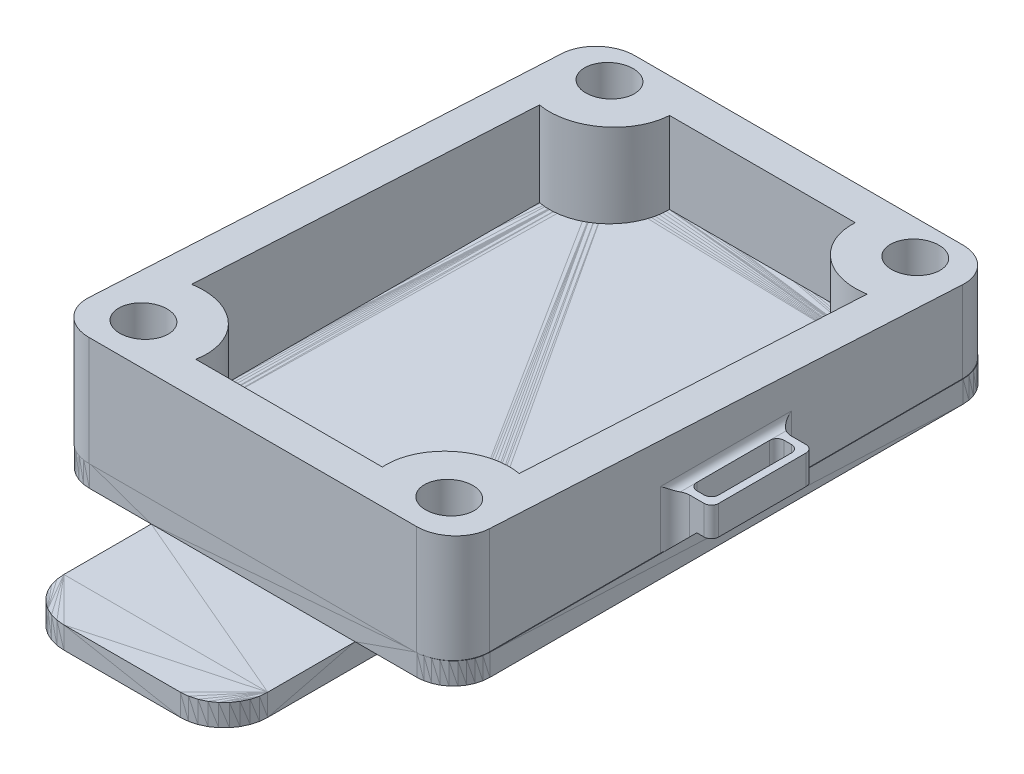
from build123d import *

# Parameters (mm, degrees)
SKETCH2_W                  = 55
SKETCH2_H                  = 75
BOSS_EXTRUDE1_DEPTH        = 15
FILLET1_R                  = 5
SKETCH3_R                  = 3.25
CUT_EXTRUDE1_DEPTH         = 49.862050714
SKETCH4_W                  = 28
SKETCH4_H                  = 10
SKETCH4_H_2                = 12.75
SKETCH4_H_3                = 48.5
SKETCH4_W_2                = 8.5
SKETCH4_H_4                = 13.75
SKETCH4_H_5                = 18
BOSS_EXTRUDE2_DEPTH        = 3
FILLET2_R                  = 6
FILLET3_R                  = 6
SKETCH6_W                  = 76.197677356
SKETCH6_H                  = 123.01265962
CUT_EXTRUDE4_DEPTH         = 3
CUT_EXTRUDE5_DEPTH         = 49.862050714
CUT_EXTRUDE5_DEPTH_BACK    = 49.862050714
CUT_EXTRUDE6_DEPTH         = 69.23672032
CUT_EXTRUDE6_DEPTH_BACK    = 69.23672032
BOSS_EXTRUDE3_START        = -3
SKETCH8_W                  = 5
SKETCH8_H                  = 14
BOSS_EXTRUDE3_DEPTH        = 4
SKETCH9_W                  = 3
SKETCH9_H                  = 12
CUT_EXTRUDE7_DEPTH         = 51.264301447
CHAMFER1_SIZE              = 3
FILLET4_R                  = 1
FILLET5_R                  = 2
FILLET6_R                  = 1
CHAMFER2_SIZE              = 3
FILLET7_R                  = 1
FILLET8_R                  = 2
FILLET9_R                  = 1
SPLIT1_START               = -32.5
SPLIT1_OUTLINE_W           = 12
SPLIT1_OUTLINE_H           = 22
SPLIT1_DEPTH               = 5
SPLIT1_START_2             = 27.5
SPLIT1_2_OUTLINE_W         = 12
SPLIT1_2_OUTLINE_H         = 22
SPLIT1_2_DEPTH             = 5
SPLIT1_START_3             = 3
SPLIT1_3_DEPTH             = 4
SPLIT1_START_4             = -9.0000001
SPLIT1_4_DEPTH             = 18.0000001
SPLIT1_START_5             = -8.678632008
SPLIT1_5_DEPTH             = 3.678632008
SPLIT1_START_6             = 5
SPLIT1_6_DEPTH             = 2.30116
SPLIT1_START_7             = -1
SPLIT1_7_DEPTH             = 4
SPLIT1_START_8             = 7
SPLIT1_8_DEPTH             = 2
SPLIT1_9_DEPTH             = 4
SPLIT1_10_DEPTH            = 18.0000001
SPLIT1_11_DEPTH            = 3.678632008
SPLIT1_12_DEPTH            = 2.30116
SPLIT1_13_DEPTH            = 4
SPLIT1_14_DEPTH            = 2
TRUCKS_SPACER_REVC_START   = 111.078258223
TRUCKS_SPACER_REVC_DEPTH   = 6.000000052
TRUCKS_SPACER_REVC_START_2 = 114.078258249
TRUCKS_SPACER_REVC_2_DEPTH = 3.000000026
TRUCKS_SPACER_REVC_3_DEPTH = 3.000000026


with BuildPart() as part:
    # Sketch2 → Boss-Extrude1 (new body)
    with BuildSketch(Plane(origin=(0, 0, 0), x_dir=(1, 0, 0), z_dir=(0, 1, 0))):
        Rectangle(SKETCH2_W, SKETCH2_H)
    extrude(amount=BOSS_EXTRUDE1_DEPTH)

    # Fillet1
    fillet1_edges = [part.edges().sort_by_distance(p)[0] for p in [
        (27.5, 7.5, 37.5),
        (-27.5, 7.5, 37.5),
        (-27.5, 7.5, -37.5),
        (27.5, 7.5, -37.5),
    ]]
    fillet(fillet1_edges, radius=FILLET1_R)

    # Sketch3 → Cut-Extrude1 (cut, through all)
    with BuildSketch(Plane(origin=(0, 15, 0), x_dir=(1, 0, 0), z_dir=(0, 1, 0))):
        with Locations(Location((-21, 32.5, 0), (0, 0, 270))):
            Circle(SKETCH3_R)
        with Locations(Location((21, 32.5, 0), (0, 0, 270))):
            Circle(SKETCH3_R)
        with Locations(Location((21, -31.5, 0), (0, 0, 270))):
            Circle(SKETCH3_R)
        with Locations(Location((-21, -31.5, 0), (0, 0, 270))):
            Circle(SKETCH3_R)
    extrude(amount=-CUT_EXTRUDE1_DEPTH, mode=Mode.SUBTRACT)

    # Sketch4 → Boss-Extrude2 (add)
    with BuildSketch(Plane.XZ):
        with Locations((0, -42.5)):
            Rectangle(SKETCH4_W, SKETCH4_H)
        with Locations((0, -31.125)):
            Rectangle(SKETCH4_W, SKETCH4_H_2)
        with Locations((0, -0.5)):
            Rectangle(SKETCH4_W, SKETCH4_H_3)
        with Locations((18.25, -0.5)):
            Rectangle(SKETCH4_W_2, SKETCH4_H_3)
        with Locations((-18.25, -0.5)):
            Rectangle(SKETCH4_W_2, SKETCH4_H_3)
        with Locations((0, 30.625)):
            Rectangle(SKETCH4_W, SKETCH4_H_4)
        with Locations((0, 46.5)):
            Rectangle(SKETCH4_W, SKETCH4_H_5)
    extrude(amount=BOSS_EXTRUDE2_DEPTH)

    # Fillet2
    fillet2_edges = [part.edges().sort_by_distance(p)[0] for p in [
        (22.5, -1.5, -24.75),
        (22.5, -1.5, 23.75),
        (-22.5, -1.5, 23.75),
        (-22.5, -1.5, -24.75),
    ]]
    fillet(fillet2_edges, radius=FILLET2_R)

    # Fillet3
    fillet3_edges = [part.edges().sort_by_distance(p)[0] for p in [
        (-14, -1.5, -47.5),
        (14, -1.5, -47.5),
        (14, -1.5, 55.5),
        (-14, -1.5, 55.5),
    ]]
    fillet(fillet3_edges, radius=FILLET3_R)

    # Sketch6 → Cut-Extrude4 (cut)
    with BuildSketch(Plane.XZ.offset(3)):
        Rectangle(SKETCH6_W, SKETCH6_H)
    extrude(amount=-CUT_EXTRUDE4_DEPTH, mode=Mode.SUBTRACT)

    # Sketch5 → Cut-Extrude5 (cut, two sides: drawn at the far end of the back side and taken through both)
    with BuildSketch(Plane(origin=(0, 15, 0), x_dir=(1, 0, 0), z_dir=(0, 1, 0)).offset(-CUT_EXTRUDE5_DEPTH_BACK)):
        with BuildLine():
            ThreePointArc((-12.810830323, -32.5), (-15.347954536, -25.49026772), (-22.5, -23.38750963))
            Line((-22.5, -23.38750963), (-22.5, 24.38750963))
            ThreePointArc((-22.5, 24.38750963), (-15.72328227, 26.158174553), (-12.75, 32.5))
            Line((-12.75, 32.5), (-9, 32.5))
            Line((-9, 32.5), (9, 32.5))
            Line((9, 32.5), (12.75, 32.5))
            ThreePointArc((12.75, 32.5), (15.72328227, 26.158174553), (22.5, 24.38750963))
            Line((22.5, 24.38750963), (22.5, -23.38750963))
            ThreePointArc((22.5, -23.38750963), (15.347954536, -25.49026772), (12.810830323, -32.5))
            Line((12.810830323, -32.5), (9, -32.5))
            Line((9, -32.5), (-9, -32.5))
            Line((-9, -32.5), (-12.810830323, -32.5))
        make_face()
    extrude(amount=CUT_EXTRUDE5_DEPTH + CUT_EXTRUDE5_DEPTH_BACK, mode=Mode.SUBTRACT)

    # Sketch7 → Cut-Extrude6 (cut, two sides: drawn at the far end of the back side and taken through both)
    with BuildSketch(Plane(origin=(27.5, 0, 0), x_dir=(0, 0, -1), z_dir=(1, 0, 0)).offset(-CUT_EXTRUDE6_DEPTH_BACK)):
        Polygon((200.470585408, 15), (37.5, 15), (32.5, 15), (-32.5, 15), (-37.5, 15), (37.5, 11), (200.239298315, 2.320570757), (526.12625603, -3.62397497), (526.357543123, 9.055454274), align=None)
    extrude(amount=CUT_EXTRUDE6_DEPTH + CUT_EXTRUDE6_DEPTH_BACK, mode=Mode.SUBTRACT)

    # Sketch8 → Boss-Extrude3 (add)
    with BuildSketch(Plane.XZ.offset(BOSS_EXTRUDE3_START)):
        with Locations((-30, 0)):
            Rectangle(SKETCH8_W, SKETCH8_H)
    boss_extrude3 = extrude(amount=-BOSS_EXTRUDE3_DEPTH)

    # Sketch9 → Cut-Extrude7 (cut, symmetric)
    with BuildSketch(Plane(origin=(0, 7, 0), x_dir=(1, 0, 0), z_dir=(0, 1, 0))):
        with Locations((-30, 0)):
            Rectangle(SKETCH9_W, SKETCH9_H)
    cut_extrude7 = extrude(amount=CUT_EXTRUDE7_DEPTH, both=True, mode=Mode.SUBTRACT)

    # Chamfer1
    # the kernel refuses this chamfer: 3 mm, written as the material it adds along each edge
    with BuildSketch(Plane(origin=(-27.5, 3, -7), x_dir=(0, -1, 0), z_dir=(0, 0, 1))) as chamfer1_piece_1_section:
        Polygon((CHAMFER1_SIZE, 0), (0, -CHAMFER1_SIZE), (0, 0), align=None)
    chamfer1_piece_1 = extrude(amount=14, mode=Mode.PRIVATE)
    chamfer1_piece_1 = split(chamfer1_piece_1, bisect_by=Plane(origin=(-27.5, 0, -7), z_dir=(0, 1, 0)), keep=Keep.TOP, mode=Mode.PRIVATE)
    chamfer1_piece_1 = split(chamfer1_piece_1, bisect_by=Plane(origin=(-27.5, 3, -6), z_dir=(0, 0, -1)), keep=Keep.TOP, mode=Mode.PRIVATE)
    chamfer1_piece_1 = split(chamfer1_piece_1, bisect_by=Plane(origin=(-28.5, 3, -7), z_dir=(1, 0, 0)), keep=Keep.TOP, mode=Mode.PRIVATE)
    add(chamfer1_piece_1)
    with BuildSketch(Plane(origin=(-27.5, 3, -7), x_dir=(0, -1, 0), z_dir=(0, 0, 1))) as chamfer1_piece_2_section:
        Polygon((CHAMFER1_SIZE, 0), (0, -CHAMFER1_SIZE), (0, 0), align=None)
    chamfer1_piece_2 = extrude(amount=14, mode=Mode.PRIVATE)
    chamfer1_piece_2 = split(chamfer1_piece_2, bisect_by=Plane(origin=(-27.5, 3, -6), z_dir=(0, 0, -1)), keep=Keep.TOP, mode=Mode.PRIVATE)
    chamfer1_piece_2 = split(chamfer1_piece_2, bisect_by=Plane(origin=(-28.5, 3, -7), z_dir=(-1, 0, 0)), keep=Keep.TOP, mode=Mode.PRIVATE)
    add(chamfer1_piece_2)
    with BuildSketch(Plane(origin=(-27.5, 3, -7), x_dir=(0, -1, 0), z_dir=(0, 0, 1))) as chamfer1_piece_3_section:
        Polygon((CHAMFER1_SIZE, 0), (0, -CHAMFER1_SIZE), (0, 0), align=None)
    chamfer1_piece_3 = extrude(amount=14, mode=Mode.PRIVATE)
    chamfer1_piece_3 = split(chamfer1_piece_3, bisect_by=Plane(origin=(-27.5, 0, -7), z_dir=(0, 1, 0)), keep=Keep.TOP, mode=Mode.PRIVATE)
    chamfer1_piece_3 = split(chamfer1_piece_3, bisect_by=Plane(origin=(-27.5, 3, 6), z_dir=(0, 0, -1)), keep=Keep.TOP, mode=Mode.PRIVATE)
    chamfer1_piece_3 = split(chamfer1_piece_3, bisect_by=Plane(origin=(-27.5, 3, -6), z_dir=(0, 0, 1)), keep=Keep.TOP, mode=Mode.PRIVATE)
    chamfer1_piece_3 = split(chamfer1_piece_3, bisect_by=Plane(origin=(-28.5, 3, -7), z_dir=(1, 0, 0)), keep=Keep.TOP, mode=Mode.PRIVATE)
    add(chamfer1_piece_3)
    with BuildSketch(Plane(origin=(-27.5, 3, -7), x_dir=(0, -1, 0), z_dir=(0, 0, 1))) as chamfer1_piece_4_section:
        Polygon((CHAMFER1_SIZE, 0), (0, -CHAMFER1_SIZE), (0, 0), align=None)
    chamfer1_piece_4 = extrude(amount=14, mode=Mode.PRIVATE)
    chamfer1_piece_4 = split(chamfer1_piece_4, bisect_by=Plane(origin=(-27.5, 0, -7), z_dir=(0, 1, 0)), keep=Keep.TOP, mode=Mode.PRIVATE)
    chamfer1_piece_4 = split(chamfer1_piece_4, bisect_by=Plane(origin=(-27.5, 3, 6), z_dir=(0, 0, 1)), keep=Keep.TOP, mode=Mode.PRIVATE)
    chamfer1_piece_4 = split(chamfer1_piece_4, bisect_by=Plane(origin=(-28.5, 3, -7), z_dir=(1, 0, 0)), keep=Keep.TOP, mode=Mode.PRIVATE)
    add(chamfer1_piece_4)
    with BuildSketch(Plane(origin=(-27.5, 3, -7), x_dir=(0, -1, 0), z_dir=(0, 0, 1))) as chamfer1_piece_5_section:
        Polygon((CHAMFER1_SIZE, 0), (0, -CHAMFER1_SIZE), (0, 0), align=None)
    chamfer1_piece_5 = extrude(amount=14, mode=Mode.PRIVATE)
    chamfer1_piece_5 = split(chamfer1_piece_5, bisect_by=Plane(origin=(-27.5, 3, 6), z_dir=(0, 0, 1)), keep=Keep.TOP, mode=Mode.PRIVATE)
    chamfer1_piece_5 = split(chamfer1_piece_5, bisect_by=Plane(origin=(-28.5, 3, -7), z_dir=(-1, 0, 0)), keep=Keep.TOP, mode=Mode.PRIVATE)
    add(chamfer1_piece_5)

    # Fillet4
    fillet4_edges = [part.edges().sort_by_distance(p)[0] for p in [
        (-32.5, 5, -7),
        (-32.5, 5, 7),
        (-28.5, 4, 6),
        (-31.5, 5, 6),
        (-31.5, 5, -6),
        (-28.5, 4, -6),
    ]]
    fillet(fillet4_edges, radius=FILLET4_R)

    # Fillet5
    # the kernel refuses this fillet: 2 mm, written as the material it adds along each edge
    with BuildSketch(Plane(origin=(-27.5, 7, -7), x_dir=(-1, 0, 0), z_dir=(0, -1, 0))) as fillet5_piece_1_section:
        with BuildLine():
            CenterArc((FILLET5_R, FILLET5_R), FILLET5_R, 180, 90)
            Line((0, FILLET5_R), (0, 0))
            Line((0, 0), (FILLET5_R, 0))
        make_face()
    fillet5_piece_1 = extrude(amount=7, mode=Mode.PRIVATE)
    fillet5_piece_1 = split(fillet5_piece_1, bisect_by=Plane(origin=(-31, 3.5, -7), z_dir=(0.7071067811865476, 0.7071067811865476, 0)), keep=Keep.TOP, mode=Mode.PRIVATE)
    add(fillet5_piece_1)
    with BuildSketch(Plane(origin=(-27.5, 0, 7), x_dir=(-1, 0, 0), z_dir=(0, 1, 0))) as fillet5_piece_2_section:
        with BuildLine():
            CenterArc((FILLET5_R, FILLET5_R), FILLET5_R, 180, 90)
            Line((0, FILLET5_R), (0, 0))
            Line((0, 0), (FILLET5_R, 0))
        make_face()
    fillet5_piece_2 = extrude(amount=7, mode=Mode.PRIVATE)
    fillet5_piece_2 = split(fillet5_piece_2, bisect_by=Plane(origin=(-27.5, 0, 7), z_dir=(0.7071067811865476, 0.7071067811865476, 0)), keep=Keep.TOP, mode=Mode.PRIVATE)
    add(fillet5_piece_2)

    # Fillet6
    fillet6_edges = [part.edges().sort_by_distance(p)[0] for p in [
        (-27.5, 7, 0),
    ]]
    fillet(fillet6_edges, radius=FILLET6_R - 0.0001)  # a hair under: the kernel refuses the full size

    # Mirror1: Boss-Extrude3, Cut-Extrude7 across plane
    add(boss_extrude3.mirror(Plane.ZY))
    add(cut_extrude7.mirror(Plane.ZY), mode=Mode.SUBTRACT)

    # Chamfer2
    # the kernel refuses this chamfer: 3 mm, written as the material it adds along each edge
    with BuildSketch(Plane(origin=(27.5, 3, -7), x_dir=(0, -1, 0), z_dir=(0, 0, 1))) as chamfer2_piece_1_section:
        Polygon((CHAMFER2_SIZE, 0), (0, CHAMFER2_SIZE), (0, 0), align=None)
    chamfer2_piece_1 = extrude(amount=14, mode=Mode.PRIVATE)
    chamfer2_piece_1 = split(chamfer2_piece_1, bisect_by=Plane(origin=(27.5, 0, -7), z_dir=(0, 1, 0)), keep=Keep.TOP, mode=Mode.PRIVATE)
    chamfer2_piece_1 = split(chamfer2_piece_1, bisect_by=Plane(origin=(27.5, 3, -6), z_dir=(0, 0, -1)), keep=Keep.TOP, mode=Mode.PRIVATE)
    chamfer2_piece_1 = split(chamfer2_piece_1, bisect_by=Plane(origin=(28.5, 3, -7), z_dir=(-1, 0, 0)), keep=Keep.TOP, mode=Mode.PRIVATE)
    add(chamfer2_piece_1)
    with BuildSketch(Plane(origin=(27.5, 3, -7), x_dir=(0, -1, 0), z_dir=(0, 0, 1))) as chamfer2_piece_2_section:
        Polygon((CHAMFER2_SIZE, 0), (0, CHAMFER2_SIZE), (0, 0), align=None)
    chamfer2_piece_2 = extrude(amount=14, mode=Mode.PRIVATE)
    chamfer2_piece_2 = split(chamfer2_piece_2, bisect_by=Plane(origin=(27.5, 3, -6), z_dir=(0, 0, -1)), keep=Keep.TOP, mode=Mode.PRIVATE)
    chamfer2_piece_2 = split(chamfer2_piece_2, bisect_by=Plane(origin=(28.5, 3, -7), z_dir=(1, 0, 0)), keep=Keep.TOP, mode=Mode.PRIVATE)
    add(chamfer2_piece_2)
    with BuildSketch(Plane(origin=(27.5, 3, -7), x_dir=(0, -1, 0), z_dir=(0, 0, 1))) as chamfer2_piece_3_section:
        Polygon((CHAMFER2_SIZE, 0), (0, CHAMFER2_SIZE), (0, 0), align=None)
    chamfer2_piece_3 = extrude(amount=14, mode=Mode.PRIVATE)
    chamfer2_piece_3 = split(chamfer2_piece_3, bisect_by=Plane(origin=(27.5, 0, -7), z_dir=(0, 1, 0)), keep=Keep.TOP, mode=Mode.PRIVATE)
    chamfer2_piece_3 = split(chamfer2_piece_3, bisect_by=Plane(origin=(27.5, 3, -6), z_dir=(0, 0, 1)), keep=Keep.TOP, mode=Mode.PRIVATE)
    chamfer2_piece_3 = split(chamfer2_piece_3, bisect_by=Plane(origin=(28.5, 3, -7), z_dir=(-1, 0, 0)), keep=Keep.TOP, mode=Mode.PRIVATE)
    chamfer2_piece_3 = split(chamfer2_piece_3, bisect_by=Plane(origin=(27.5, 3, 6), z_dir=(0, 0, -1)), keep=Keep.TOP, mode=Mode.PRIVATE)
    add(chamfer2_piece_3)
    with BuildSketch(Plane(origin=(27.5, 3, -7), x_dir=(0, -1, 0), z_dir=(0, 0, 1))) as chamfer2_piece_4_section:
        Polygon((CHAMFER2_SIZE, 0), (0, CHAMFER2_SIZE), (0, 0), align=None)
    chamfer2_piece_4 = extrude(amount=14, mode=Mode.PRIVATE)
    chamfer2_piece_4 = split(chamfer2_piece_4, bisect_by=Plane(origin=(27.5, 0, -7), z_dir=(0, 1, 0)), keep=Keep.TOP, mode=Mode.PRIVATE)
    chamfer2_piece_4 = split(chamfer2_piece_4, bisect_by=Plane(origin=(28.5, 3, -7), z_dir=(-1, 0, 0)), keep=Keep.TOP, mode=Mode.PRIVATE)
    chamfer2_piece_4 = split(chamfer2_piece_4, bisect_by=Plane(origin=(27.5, 3, 6), z_dir=(0, 0, 1)), keep=Keep.TOP, mode=Mode.PRIVATE)
    add(chamfer2_piece_4)
    with BuildSketch(Plane(origin=(27.5, 3, -7), x_dir=(0, -1, 0), z_dir=(0, 0, 1))) as chamfer2_piece_5_section:
        Polygon((CHAMFER2_SIZE, 0), (0, CHAMFER2_SIZE), (0, 0), align=None)
    chamfer2_piece_5 = extrude(amount=14, mode=Mode.PRIVATE)
    chamfer2_piece_5 = split(chamfer2_piece_5, bisect_by=Plane(origin=(28.5, 3, -7), z_dir=(1, 0, 0)), keep=Keep.TOP, mode=Mode.PRIVATE)
    chamfer2_piece_5 = split(chamfer2_piece_5, bisect_by=Plane(origin=(27.5, 3, 6), z_dir=(0, 0, 1)), keep=Keep.TOP, mode=Mode.PRIVATE)
    add(chamfer2_piece_5)

    # Fillet7
    fillet7_edges = [part.edges().sort_by_distance(p)[0] for p in [
        (32.5, 5, -7),
        (32.5, 5, 7),
        (31.5, 5, -6),
        (31.5, 5, 6),
        (28.5, 4, -6),
        (28.5, 4, 6),
    ]]
    fillet(fillet7_edges, radius=FILLET7_R)

    # Fillet8
    # the kernel refuses this fillet: 2 mm, written as the material it adds along each edge
    with BuildSketch(Plane(origin=(27.5, 0, -7), x_dir=(1, 0, 0), z_dir=(0, 1, 0))) as fillet8_piece_1_section:
        with BuildLine():
            CenterArc((FILLET8_R, FILLET8_R), FILLET8_R, 180, 90)
            Line((0, FILLET8_R), (0, 0))
            Line((0, 0), (FILLET8_R, 0))
        make_face()
    fillet8_piece_1 = extrude(amount=7, mode=Mode.PRIVATE)
    fillet8_piece_1 = split(fillet8_piece_1, bisect_by=Plane(origin=(27.5, 0, -7), z_dir=(-0.7071067811865476, 0.7071067811865476, 0)), keep=Keep.TOP, mode=Mode.PRIVATE)
    add(fillet8_piece_1)
    with BuildSketch(Plane(origin=(27.5, 7, 7), x_dir=(1, 0, 0), z_dir=(0, -1, 0))) as fillet8_piece_2_section:
        with BuildLine():
            CenterArc((FILLET8_R, FILLET8_R), FILLET8_R, 180, 90)
            Line((0, FILLET8_R), (0, 0))
            Line((0, 0), (FILLET8_R, 0))
        make_face()
    fillet8_piece_2 = extrude(amount=7, mode=Mode.PRIVATE)
    fillet8_piece_2 = split(fillet8_piece_2, bisect_by=Plane(origin=(31, 3.5, 7), z_dir=(-0.7071067811865476, 0.7071067811865476, 0)), keep=Keep.TOP, mode=Mode.PRIVATE)
    add(fillet8_piece_2)

    # Fillet9
    fillet9_edges = [part.edges().sort_by_distance(p)[0] for p in [
        (27.5, 7, 0),
    ]]
    fillet(fillet9_edges, radius=FILLET9_R - 0.0001)  # a hair under: the kernel refuses the full size

    # Split1: read off the stored shape, not the designer's step
    # Split1 outline → Split1 (cut)
    with BuildSketch(Plane.YZ.offset(SPLIT1_START)):
        with Locations((4, 0)):
            Rectangle(SPLIT1_OUTLINE_W, SPLIT1_OUTLINE_H)
    extrude(amount=SPLIT1_DEPTH, mode=Mode.SUBTRACT)

    # Split1 2 outline → Split1 2 (cut)
    with BuildSketch(Plane.YZ.offset(SPLIT1_START_2)):
        with Locations((4, 0)):
            Rectangle(SPLIT1_2_OUTLINE_W, SPLIT1_2_OUTLINE_H)
    extrude(amount=SPLIT1_2_DEPTH, mode=Mode.SUBTRACT)


with BuildPart() as body_2:
    # Split1 3 outline → Split1 3 (new body)
    with BuildSketch(Plane(origin=(0, 0, 0), x_dir=(1, 0, 0), z_dir=(0, 1, 0)).offset(SPLIT1_START_3)):
        with BuildLine():
            Line((27.5, 9), (27.5, -9))
            ThreePointArc((27.5, -9), (28.085786438, -7.585786438), (29.5, -7))
            Line((29.5, -7), (31.5, -7))
            ThreePointArc((31.5, -7), (32.207106781, -6.707106781), (32.5, -6))
            Line((32.5, -6), (32.5, 6))
            ThreePointArc((32.5, 6), (32.207106781, 6.707106781), (31.5, 7))
            Line((31.5, 7), (29.5, 7))
            ThreePointArc((29.5, 7), (28.085786438, 7.585786438), (27.5, 9))
        make_face()
        with BuildLine():
            Line((31.5, 5), (31.5, -5))
            ThreePointArc((31.5, -5), (31.207106781, -5.707106781), (30.5, -6))
            Line((30.5, -6), (29.5, -6))
            ThreePointArc((29.5, -6), (28.792893219, -5.707106781), (28.5, -5))
            Line((28.5, -5), (28.5, 5))
            ThreePointArc((28.5, 5), (28.792893219, 5.707106781), (29.5, 6))
            Line((29.5, 6), (30.5, 6))
            ThreePointArc((30.5, 6), (31.207106781, 5.707106781), (31.5, 5))
        make_face(mode=Mode.SUBTRACT)
    extrude(amount=SPLIT1_3_DEPTH)

    # Split1 4 outline → Split1 4 (add)
    with BuildSketch(Plane.XY.offset(SPLIT1_START_4)):
        Polygon((27.5, 3), (27.5, 0), (28.5, 1), (28.5, 3), align=None)
        with BuildLine():
            Line((27.5, 8), (27.5, 7))
            Line((27.5, 7), (28.5, 7))
            ThreePointArc((28.5, 7), (27.792893219, 7.292893219), (27.5, 8))
        make_face()
    extrude(amount=SPLIT1_4_DEPTH)

    # Split1 5 outline → Split1 5 (add)
    with BuildSketch(Plane.XY.offset(SPLIT1_START_5)):
        Polygon((28.5, 3), (28.5, 1), (30.5, 3), align=None)
    extrude(amount=SPLIT1_5_DEPTH)

    # Split1 6 outline → Split1 6 (add)
    with BuildSketch(Plane.XY.offset(SPLIT1_START_6)):
        Polygon((28.5, 3), (28.5, 1), (30.5, 3), align=None)
    extrude(amount=SPLIT1_6_DEPTH)

    # Split1 7 outline → Split1 7 (cut)
    with BuildSketch(Plane(origin=(0, 0, 0), x_dir=(1, 0, 0), z_dir=(0, 1, 0)).offset(SPLIT1_START_7)):
        with BuildLine():
            ThreePointArc((28.5, -5), (28.792893219, -5.707106781), (29.5, -6))
            Line((29.5, -6), (32, -6))
            Line((32, -6), (32, -5))
            Line((32, -5), (28.5, -5))
        make_face()
        with BuildLine():
            Line((32, -7.30116), (32, -7))
            Line((32, -7), (29.5, -7))
            ThreePointArc((29.5, -7), (28.085786438, -7.585786438), (27.5, -9))
            Line((27.5, -9), (28.5, -9))
            Line((28.5, -9), (28.5, -7.30116))
            Line((28.5, -7.30116), (32, -7.30116))
        make_face()
        with BuildLine():
            Line((28.5, 5), (32, 5))
            Line((32, 5), (32, 6))
            Line((32, 6), (29.5, 6))
            ThreePointArc((29.5, 6), (28.792893219, 5.707106781), (28.5, 5))
        make_face()
        with BuildLine():
            Line((29.5, 7), (32, 7))
            Line((32, 7), (32, 8.678632008))
            Line((32, 8.678632008), (28.5, 8.678632008))
            Line((28.5, 8.678632008), (28.5, 9.0000001))
            Line((28.5, 9.0000001), (27.5, 9))
            ThreePointArc((27.5, 9), (28.085786438, 7.585786438), (29.5, 7))
        make_face()
    extrude(amount=SPLIT1_7_DEPTH, mode=Mode.SUBTRACT)

    # Split1 8 outline → Split1 8 (cut)
    with BuildSketch(Plane(origin=(0, 0, 0), x_dir=(1, 0, 0), z_dir=(0, 1, 0)).offset(SPLIT1_START_8)):
        with BuildLine():
            Line((32, -7.30116), (32, -7))
            Line((32, -7), (29.5, -7))
            ThreePointArc((29.5, -7), (28.085786438, -7.585786438), (27.5, -9))
            Line((27.5, -9), (28.5, -9))
            Line((28.5, -9), (28.5, -7.30116))
            Line((28.5, -7.30116), (32, -7.30116))
        make_face()
        with BuildLine():
            Line((29.5, 7), (32, 7))
            Line((32, 7), (32, 8.678632008))
            Line((32, 8.678632008), (28.5, 8.678632008))
            Line((28.5, 8.678632008), (28.5, 9.0000001))
            Line((28.5, 9.0000001), (27.5, 9))
            ThreePointArc((27.5, 9), (28.085786438, 7.585786438), (29.5, 7))
        make_face()
    extrude(amount=SPLIT1_8_DEPTH, mode=Mode.SUBTRACT)


with BuildPart() as body_3:
    # Split1 9 outline → Split1 9 (new body)
    with BuildSketch(Plane(origin=(0, 0, 0), x_dir=(1, 0, 0), z_dir=(0, 1, 0)).offset(SPLIT1_START_3)):
        with BuildLine():
            Line((-27.5, -9), (-27.5, 9))
            ThreePointArc((-27.5, 9), (-28.085786438, 7.585786438), (-29.5, 7))
            Line((-29.5, 7), (-31.5, 7))
            ThreePointArc((-31.5, 7), (-32.207106781, 6.707106781), (-32.5, 6))
            Line((-32.5, 6), (-32.5, -6))
            ThreePointArc((-32.5, -6), (-32.207106781, -6.707106781), (-31.5, -7))
            Line((-31.5, -7), (-29.5, -7))
            ThreePointArc((-29.5, -7), (-28.085786438, -7.585786438), (-27.5, -9))
        make_face()
        with BuildLine():
            Line((-28.5, 5), (-28.5, -5))
            ThreePointArc((-28.5, -5), (-28.792893219, -5.707106781), (-29.5, -6))
            Line((-29.5, -6), (-30.5, -6))
            ThreePointArc((-30.5, -6), (-31.207106781, -5.707106781), (-31.5, -5))
            Line((-31.5, -5), (-31.5, 5))
            ThreePointArc((-31.5, 5), (-31.207106781, 5.707106781), (-30.5, 6))
            Line((-30.5, 6), (-29.5, 6))
            ThreePointArc((-29.5, 6), (-28.792893219, 5.707106781), (-28.5, 5))
        make_face(mode=Mode.SUBTRACT)
    extrude(amount=SPLIT1_9_DEPTH)

    # Split1 10 outline → Split1 10 (add)
    with BuildSketch(Plane.XY.offset(SPLIT1_START_4)):
        with BuildLine():
            Line((-27.5, 7), (-27.5, 8))
            ThreePointArc((-27.5, 8), (-27.792893219, 7.292893219), (-28.5, 7))
            Line((-28.5, 7), (-27.5, 7))
        make_face()
        Polygon((-27.5, 0), (-27.5, 3), (-28.5, 3), (-28.5, 1), align=None)
    extrude(amount=SPLIT1_10_DEPTH)

    # Split1 11 outline → Split1 11 (add)
    with BuildSketch(Plane.XY.offset(SPLIT1_START_5)):
        Polygon((-28.5, 1), (-28.5, 3), (-30.5, 3), align=None)
    extrude(amount=SPLIT1_11_DEPTH)

    # Split1 12 outline → Split1 12 (add)
    with BuildSketch(Plane.XY.offset(SPLIT1_START_6)):
        Polygon((-28.5, 1), (-28.5, 3), (-30.5, 3), align=None)
    extrude(amount=SPLIT1_12_DEPTH)

    # Split1 13 outline → Split1 13 (cut)
    with BuildSketch(Plane(origin=(0, 0, 0), x_dir=(1, 0, 0), z_dir=(0, 1, 0)).offset(SPLIT1_START_7)):
        with BuildLine():
            Line((-32, 7), (-29.5, 7))
            ThreePointArc((-29.5, 7), (-28.085786438, 7.585786438), (-27.5, 9))
            Line((-27.5, 9), (-28.5, 9.0000001))
            Line((-28.5, 9.0000001), (-28.5, 8.678632008))
            Line((-28.5, 8.678632008), (-32, 8.678632008))
            Line((-32, 8.678632008), (-32, 7))
        make_face()
        with BuildLine():
            Line((-29.5, 6), (-32, 6))
            Line((-32, 6), (-32, 5))
            Line((-32, 5), (-28.5, 5))
            ThreePointArc((-28.5, 5), (-28.792893219, 5.707106781), (-29.5, 6))
        make_face()
        with BuildLine():
            Line((-28.5, -5), (-32, -5))
            Line((-32, -5), (-32, -6))
            Line((-32, -6), (-29.5, -6))
            ThreePointArc((-29.5, -6), (-28.792893219, -5.707106781), (-28.5, -5))
        make_face()
        with BuildLine():
            Line((-29.5, -7), (-32, -7))
            Line((-32, -7), (-32, -7.30116))
            Line((-32, -7.30116), (-28.5, -7.30116))
            Line((-28.5, -7.30116), (-28.5, -9))
            Line((-28.5, -9), (-27.5, -9))
            ThreePointArc((-27.5, -9), (-28.085786438, -7.585786438), (-29.5, -7))
        make_face()
    extrude(amount=SPLIT1_13_DEPTH, mode=Mode.SUBTRACT)

    # Split1 14 outline → Split1 14 (cut)
    with BuildSketch(Plane(origin=(0, 0, 0), x_dir=(1, 0, 0), z_dir=(0, 1, 0)).offset(SPLIT1_START_8)):
        with BuildLine():
            Line((-32, 7), (-29.5, 7))
            ThreePointArc((-29.5, 7), (-28.085786438, 7.585786438), (-27.5, 9))
            Line((-27.5, 9), (-28.5, 9.0000001))
            Line((-28.5, 9.0000001), (-28.5, 8.678632008))
            Line((-28.5, 8.678632008), (-32, 8.678632008))
            Line((-32, 8.678632008), (-32, 7))
        make_face()
        with BuildLine():
            Line((-29.5, -7), (-32, -7))
            Line((-32, -7), (-32, -7.30116))
            Line((-32, -7.30116), (-28.5, -7.30116))
            Line((-28.5, -7.30116), (-28.5, -9))
            Line((-28.5, -9), (-27.5, -9))
            ThreePointArc((-27.5, -9), (-28.085786438, -7.585786438), (-29.5, -7))
        make_face()
    extrude(amount=SPLIT1_14_DEPTH, mode=Mode.SUBTRACT)


with BuildPart() as body_4:
    # Trucks_Spacer_RevC: read off the stored shape, not the designer's step
    # Trucks_Spacer_RevC outline → Trucks_Spacer_RevC (new body)
    with BuildSketch(Plane(origin=(0, 0, 0), x_dir=(1, 0, 0), z_dir=(0, 1, 0)).offset(TRUCKS_SPACER_REVC_START)):
        Polygon((9.367287415, 37.501967036), (-18.632711587, 37.501967036), (-18.632711587, 24.751965412), (-21.132711065, 24.751965412), (-22.174600256, 24.660811284), (-23.184831929, 24.390120515), (-24.132711557, 23.948118546), (-24.989437056, 23.348231324), (-25.72897796, 22.608690419), (-26.32886332, 21.75196492), (-26.770867151, 20.804087156), (-27.04155792, 19.793855482), (-27.132712048, 18.751966291), (-27.132712048, -17.748036898), (-27.04155792, -18.789918638), (-26.770867151, -19.800157762), (-26.32886332, -20.748035527), (-25.72897796, -21.604762888), (-24.989437056, -22.344300068), (-24.132711557, -22.944183565), (-23.184831929, -23.386189259), (-22.174600256, -23.656876302), (-21.132711065, -23.748034156), (-18.632711587, -23.748034156), (-18.632711587, -37.498035944), (9.367287415, -37.498035944), (9.367287415, -23.748034156), (11.867288756, -23.748034156), (12.909177947, -23.656876302), (13.919409621, -23.386189259), (14.867287385, -22.944183565), (15.724014747, -22.344300068), (16.463555652, -21.604762888), (17.063439149, -20.748035527), (17.505444842, -19.800157762), (17.776135611, -18.789918638), (17.86728974, -17.748036898), (17.86728974, 18.751966291), (17.776135611, 19.793855482), (17.505444842, 20.804087156), (17.063439149, 21.75196492), (16.463555652, 22.608690419), (15.724014747, 23.348231324), (14.867287385, 23.948118546), (13.919409621, 24.390120515), (12.909177947, 24.660811284), (11.867288756, 24.751965412), (9.367287415, 24.751965412), align=None)
    extrude(amount=TRUCKS_SPACER_REVC_DEPTH)

    # Trucks_Spacer_RevC 2 outline → Trucks_Spacer_RevC 2 (add)
    # profile 1 of 2: a face of its own
    with BuildSketch(Plane(origin=(0, 0, 0), x_dir=(1, 0, 0), z_dir=(0, 1, 0)).offset(TRUCKS_SPACER_REVC_START_2)):
        Polygon((-18.632711587, 24.751965412), (-18.632711587, 37.501967036), (-27.132712048, 37.501967036), (-28.00095242, 37.426004642), (-28.842812148, 37.200427138), (-29.632711527, 36.832092785), (-30.346648511, 36.33218863), (-30.962932715, 35.71590268), (-31.462838617, 35.001965695), (-31.831174833, 34.212066316), (-32.056750474, 33.370206588), (-32.132711005, 32.501964354), (-32.132711005, -32.498033262), (-32.056750474, -33.366271771), (-31.831174833, -34.208135224), (-31.462838617, -34.998038328), (-30.962932715, -35.711967862), (-30.346648511, -36.328257537), (-29.632711527, -36.828161693), (-28.842812148, -37.196496046), (-28.00095242, -37.422077275), (-27.132712048, -37.498035944), (-18.632711587, -37.498035944), (-18.632711587, -23.748034156), (-21.132711065, -23.748034156), (-22.174600256, -23.656876302), (-23.184831929, -23.386189259), (-24.132711557, -22.944183565), (-24.989437056, -22.344300068), (-25.72897796, -21.604762888), (-26.32886332, -20.748035527), (-26.770867151, -19.800157762), (-27.04155792, -18.789918638), (-27.132712048, -17.748036898), (-27.132712048, 18.751966291), (-27.04155792, 19.793855482), (-26.770867151, 20.804087156), (-26.32886332, 21.75196492), (-25.72897796, 22.608690419), (-24.989437056, 23.348231324), (-24.132711557, 23.948118546), (-23.184831929, 24.390120515), (-22.174600256, 24.660811284), (-21.132711065, 24.751965412), align=None)
        Polygon((-27.132712048, -29.39996264), (-26.658771303, -29.178956068), (-26.153655467, -29.043616272), (-25.632710871, -28.998033619), (-25.111766276, -29.043616272), (-24.606650439, -29.178956068), (-24.132711557, -29.39996264), (-23.704347876, -29.699900663), (-23.334577423, -30.069665528), (-23.034635675, -30.498036659), (-22.813632828, -30.971975542), (-22.678287444, -31.477095104), (-22.63271038, -31.998032249), (-22.678287444, -32.518976844), (-22.813632828, -33.024096406), (-23.034635675, -33.498035288), (-23.334577423, -33.926398969), (-23.704347876, -34.296171284), (-24.132711557, -34.596109307), (-24.606650439, -34.817108429), (-25.111766276, -34.952455676), (-25.632710871, -34.998038328), (-26.153655467, -34.952455676), (-26.658771303, -34.817108429), (-27.132712048, -34.596109307), (-27.561073867, -34.296171284), (-27.930844319, -33.926398969), (-28.23078793, -33.498035288), (-28.451788914, -33.024096406), (-28.587134299, -32.518976844), (-28.632711596, -31.998032249), (-28.587134299, -31.477095104), (-28.451788914, -30.971975542), (-28.23078793, -30.498036659), (-27.930844319, -30.069665528), (-27.561073867, -29.699900663), align=None, mode=Mode.SUBTRACT)
        Polygon((-22.678287444, 31.481022471), (-22.813632828, 30.975904771), (-23.034635675, 30.501964026), (-23.334577423, 30.073602208), (-23.704347876, 29.703831756), (-24.132711557, 29.403890007), (-24.606650439, 29.18288716), (-25.111766276, 29.047541776), (-25.632710871, 29.001964712), (-26.153655467, 29.047541776), (-26.658771303, 29.18288716), (-27.132712048, 29.403890007), (-27.561073867, 29.703831756), (-27.930844319, 30.073602208), (-28.23078793, 30.501964026), (-28.451788914, 30.975904771), (-28.587134299, 31.481022471), (-28.632711596, 32.001967066), (-28.587134299, 32.522911661), (-28.451788914, 33.028027498), (-28.23078793, 33.501967312), (-27.930844319, 33.930330061), (-27.561073867, 34.300098651), (-27.132712048, 34.6000404), (-26.658771303, 34.821043246), (-26.153655467, 34.956390494), (-25.632710871, 35.001965695), (-25.111766276, 34.956390494), (-24.606650439, 34.821043246), (-24.132711557, 34.6000404), (-23.704347876, 34.300098651), (-23.334577423, 33.930330061), (-23.034635675, 33.501967312), (-22.813632828, 33.028027498), (-22.678287444, 32.522911661), (-22.63271038, 32.001967066), align=None, mode=Mode.SUBTRACT)
    # profile 2 of 2: a face of its own
    with BuildSketch(Plane(origin=(0, 0, 0), x_dir=(1, 0, 0), z_dir=(0, 1, 0)).offset(TRUCKS_SPACER_REVC_START_2)):
        Polygon((17.86728974, 37.501967036), (9.367287415, 37.501967036), (9.367287415, 24.751965412), (11.867288756, 24.751965412), (12.909177947, 24.660811284), (13.919409621, 24.390120515), (14.867287385, 23.948118546), (15.724014747, 23.348231324), (16.463555652, 22.608690419), (17.063439149, 21.75196492), (17.505444842, 20.804087156), (17.776135611, 19.793855482), (17.86728974, 18.751966291), (17.86728974, -17.748036898), (17.776135611, -18.789918638), (17.505444842, -19.800157762), (17.063439149, -20.748035527), (16.463555652, -21.604762888), (15.724014747, -22.344300068), (14.867287385, -22.944183565), (13.919409621, -23.386189259), (12.909177947, -23.656876302), (11.867288756, -23.748034156), (9.367287415, -23.748034156), (9.367287415, -37.498035944), (17.86728974, -37.498035944), (18.735528248, -37.422077275), (19.577391702, -37.196496046), (20.367287356, -36.828161693), (21.08122434, -36.328257537), (21.69751029, -35.711967862), (22.197418171, -34.998038328), (22.565752524, -34.208135224), (22.791326302, -33.366271771), (22.867288697, -32.498033262), (22.867288697, 32.501964354), (22.791326302, 33.370206588), (22.565752524, 34.212066316), (22.197418171, 35.001965695), (21.69751029, 35.71590268), (21.08122434, 36.33218863), (20.367287356, 36.832092785), (19.577391702, 37.200427138), (18.735528248, 37.426004642), align=None)
        Polygon((15.846342105, -29.043616272), (16.367290425, -28.998033619), (16.888231295, -29.043616272), (17.393347132, -29.178956068), (17.86728974, -29.39996264), (18.295653421, -29.699900663), (18.66542201, -30.069665528), (18.965363759, -30.498036659), (19.186366606, -30.971975542), (19.321710127, -31.477095104), (19.367289054, -31.998032249), (19.321710127, -32.518976844), (19.186366606, -33.024096406), (18.965363759, -33.498035288), (18.66542201, -33.926398969), (18.295653421, -34.296171284), (17.86728974, -34.596109307), (17.393347132, -34.817108429), (16.888231295, -34.952455676), (16.367290425, -34.998038328), (15.846342105, -34.952455676), (15.341226268, -34.817108429), (14.867287385, -34.596109307), (14.438923704, -34.296171284), (14.069155115, -33.926398969), (13.769213366, -33.498035288), (13.548206794, -33.024096406), (13.412866998, -32.518976844), (13.367288071, -31.998032249), (13.412866998, -31.477095104), (13.548206794, -30.971975542), (13.769213366, -30.498036659), (14.069155115, -30.069665528), (14.438923704, -29.699900663), (14.867287385, -29.39996264), (15.341226268, -29.178956068), align=None, mode=Mode.SUBTRACT)
        Polygon((18.295653421, 29.703831756), (17.86728974, 29.403890007), (17.393347132, 29.18288716), (16.888231295, 29.047541776), (16.367290425, 29.001964712), (15.846342105, 29.047541776), (15.341226268, 29.18288716), (14.867287385, 29.403890007), (14.438923704, 29.703831756), (14.069155115, 30.073602208), (13.769213366, 30.501964026), (13.548206794, 30.975904771), (13.412866998, 31.481022471), (13.367288071, 32.001967066), (13.412866998, 32.522911661), (13.548206794, 33.028027498), (13.769213366, 33.501967312), (14.069155115, 33.930330061), (14.438923704, 34.300098651), (14.867287385, 34.6000404), (15.341226268, 34.821043246), (15.846342105, 34.956390494), (16.367290425, 35.001965695), (16.888231295, 34.956390494), (17.393347132, 34.821043246), (17.86728974, 34.6000404), (18.295653421, 34.300098651), (18.66542201, 33.930330061), (18.965363759, 33.501967312), (19.186366606, 33.028027498), (19.321710127, 32.522911661), (19.367289054, 32.001967066), (19.321710127, 31.481022471), (19.186366606, 30.975904771), (18.965363759, 30.501964026), (18.66542201, 30.073602208), align=None, mode=Mode.SUBTRACT)
    extrude(amount=TRUCKS_SPACER_REVC_2_DEPTH)

    # Trucks_Spacer_RevC 3 outline → Trucks_Spacer_RevC 3 (add)
    with BuildSketch(Plane(origin=(0, 0, 0), x_dir=(1, 0, 0), z_dir=(0, 1, 0)).offset(TRUCKS_SPACER_REVC_START)):
        Polygon((-17.828863789, 44.501966321), (-18.270866689, 43.554084831), (-18.541557458, 42.543853157), (-18.632711587, 41.501963967), (-18.632711587, 37.501967036), (9.367287415, 37.501967036), (9.367287415, 41.501963967), (9.276137012, 42.543853157), (9.005446243, 43.554084831), (8.563440549, 44.501966321), (7.963557052, 45.358689957), (7.224012422, 46.098230862), (6.367288786, 46.698118142), (5.419411021, 47.140120053), (4.409179348, 47.410810822), (3.367290157, 47.50196495), (-12.632710603, 47.50196495), (-13.674599794, 47.410810822), (-14.68483333, 47.140120053), (-15.632711095, 46.698118142), (-16.489436594, 46.098230862), (-17.228977499, 45.358689957), align=None)
        Polygon((9.367287415, -37.498035944), (-18.632711587, -37.498035944), (-18.632711587, -49.498037911), (-18.541557458, -50.539919651), (-18.270866689, -51.550151325), (-17.828863789, -52.49803654), (-17.228977499, -53.354763902), (-16.489436594, -54.094301081), (-15.632711095, -54.694184578), (-14.68483333, -55.136190272), (-13.674599794, -55.406877316), (-12.632710603, -55.498035169), (3.367290157, -55.498035169), (4.409179348, -55.406877316), (5.419411021, -55.136190272), (6.367288786, -54.694184578), (7.224012422, -54.094301081), (7.963557052, -53.354763902), (8.563440549, -52.49803654), (9.005446243, -51.550151325), (9.276137012, -50.539919651), (9.367287415, -49.498037911), align=None)
    extrude(amount=TRUCKS_SPACER_REVC_3_DEPTH)


with BuildPart() as body_4_1:
    # Body-Move/Copy1: moved
    add(body_4.part.moved(Location((4.7, -117, 0))))


solid = Compound([part.part, body_2.part, body_3.part, body_4_1.part])
